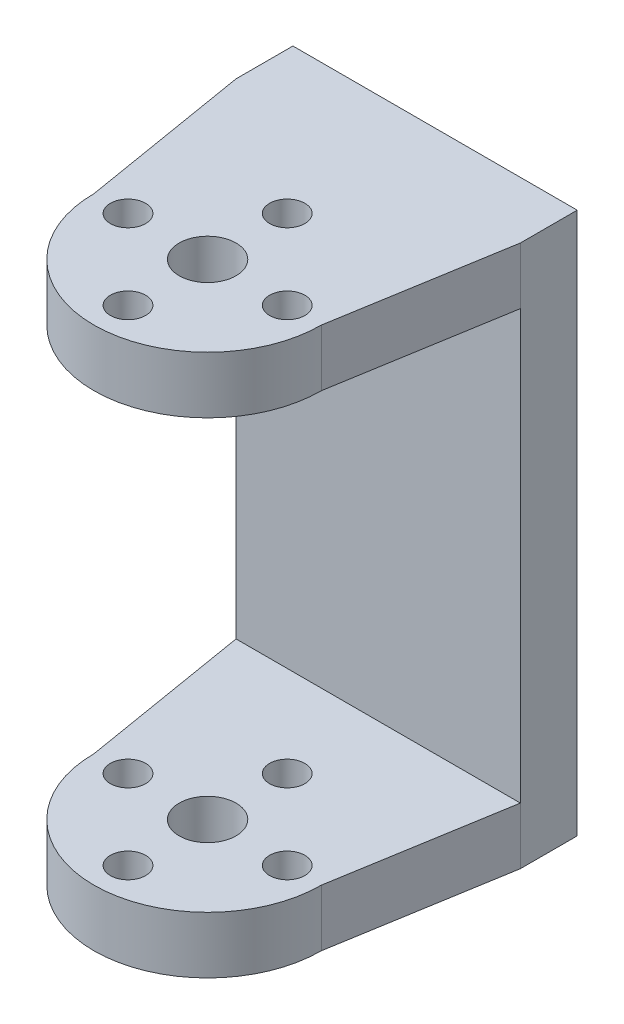
from build123d import *

# Parameters (mm, degrees)
SKETCH1_R           = 2.5
BOSS_EXTRUDE1_DEPTH = 47.65
SKETCH2_W           = 40
SKETCH2_H           = 37.65
CUT_EXTRUDE1_DEPTH  = 58.406641602
SKETCH3_R           = 1.55
CUT_EXTRUDE2_DEPTH  = 54.167400726
CIRPATTERN1_COUNT   = 4


with BuildPart() as part:
    # Sketch1 → Boss-Extrude1 (new body)
    with BuildSketch(Plane(origin=(0, 0, 0), x_dir=(1, 0, 0), z_dir=(0, 1, 0))):
        with BuildLine():
            Line((-12.5, 15), (-10, 0))
            ThreePointArc((-10, 0), (0, -10), (10, 0))
            Line((10, 0), (12.5, 15))
            Line((12.5, 15), (12.5, 20))
            Line((12.5, 20), (-12.5, 20))
            Line((-12.5, 20), (-12.5, 15))
        make_face()
        Circle(SKETCH1_R, mode=Mode.SUBTRACT)
    extrude(amount=BOSS_EXTRUDE1_DEPTH)

    # Sketch2 → Cut-Extrude1 (cut, through all)
    with BuildSketch(Plane.ZY.offset(12.5)):
        with Locations((5, 23.825)):
            Rectangle(SKETCH2_W, SKETCH2_H)
    extrude(amount=-CUT_EXTRUDE1_DEPTH, mode=Mode.SUBTRACT)

    # Sketch3 → Cut-Extrude2 (cut, through all)
    with BuildSketch(Plane(origin=(0, 47.65, 0), x_dir=(1, 0, 0), z_dir=(0, 1, 0))):
        with Locations((0, 7)):
            Circle(SKETCH3_R)
    cut_extrude2 = extrude(amount=-CUT_EXTRUDE2_DEPTH, mode=Mode.SUBTRACT)

    # CirPattern1: Cut-Extrude2 ×4 about axis
    cirpattern1_axis = Axis((0, 47.65, 0), (0, -1, 0))
    for i in range(1, CIRPATTERN1_COUNT):
        add(cut_extrude2.rotate(cirpattern1_axis, i * 360 / CIRPATTERN1_COUNT), mode=Mode.SUBTRACT)


solid = part.part
